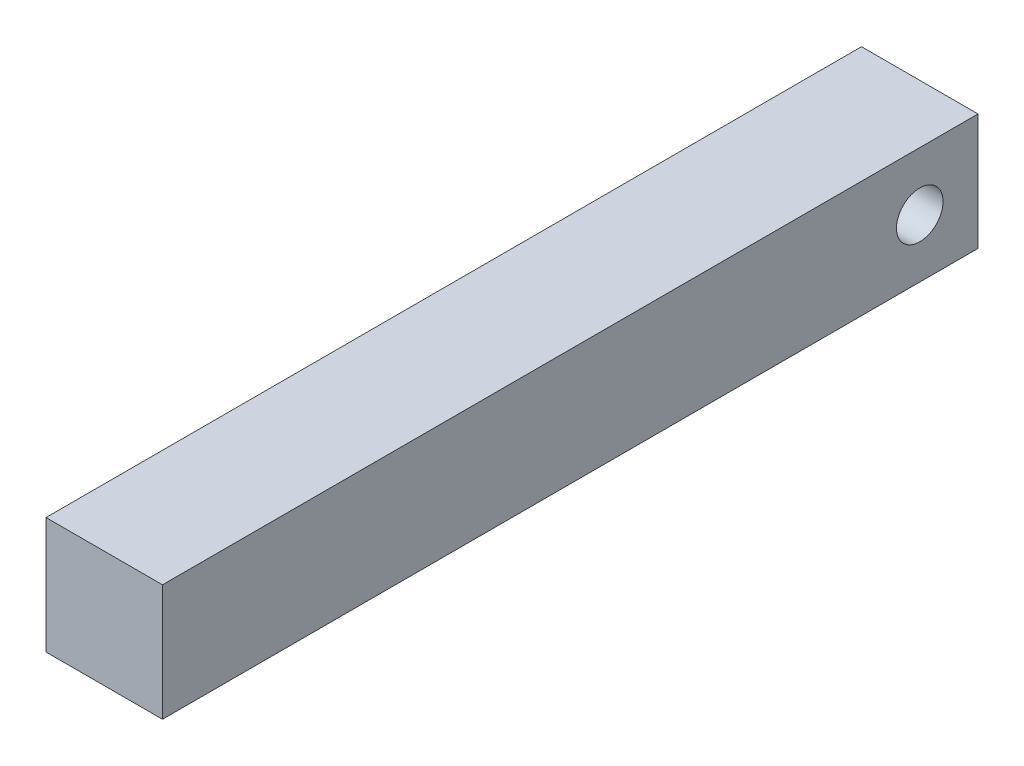
from build123d import *

# Parameters (mm, degrees)
SKETCH1_W           = 5
SKETCH1_H           = 35
BOSS_EXTRUDE1_DEPTH = 5
SKETCH2_R           = 1
CUT_EXTRUDE1_DEPTH  = 19.874586088


with BuildPart() as part:
    # Sketch1 → Boss-Extrude1 (new body)
    with BuildSketch(Plane(origin=(0, 0, 0), x_dir=(1, 0, 0), z_dir=(0, 1, 0))):
        Rectangle(SKETCH1_W, SKETCH1_H)
    extrude(amount=BOSS_EXTRUDE1_DEPTH)

    # Sketch2 → Cut-Extrude1 (cut, through all)
    with BuildSketch(Plane(origin=(2.5, 0, 0), x_dir=(0, 0, -1), z_dir=(1, 0, 0))):
        with Locations((15, 2.5)):
            Circle(SKETCH2_R)
    extrude(amount=-CUT_EXTRUDE1_DEPTH, mode=Mode.SUBTRACT)


solid = part.part
